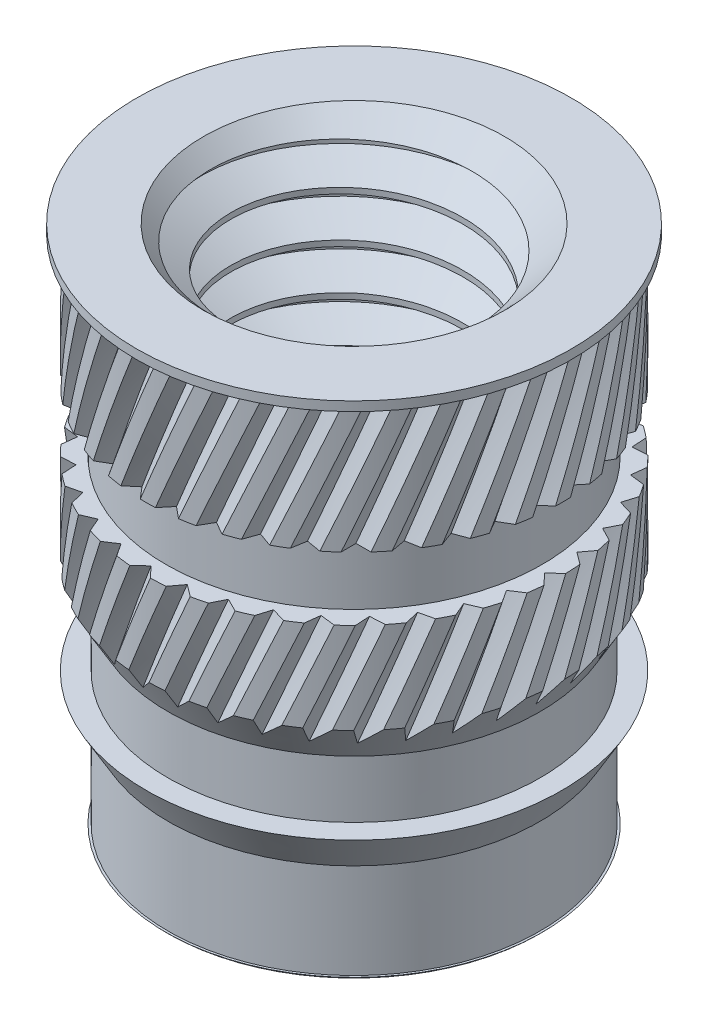
from build123d import *

# Parameters (mm, degrees)
SKETCH1_R              = 5.095
EXTRUDE1_DEPTH         = 14.3
SKETCH1_4_R            = 5.69
EXTRUDE2_DEPTH         = 8.005853
SKETCH1_3_R            = 5.955
EXTRUDE3_DEPTH         = 0.254
SKETCH2_R              = 5.69
EXTRUDE4_DEPTH         = 1.03057
EXTRUDE4_TAPER         = 30
SKETCH8_R              = 3.188101184
EXTRUDE6_DEPTH         = 14.3
CHAMFER1_SIZE          = 0.9375
CUT_SWEEP1_PITCH       = 1.25
CUT_SWEEP1_HEIGHT      = 15.864159265
CUT_SWEEP1_RADIUS      = 4
CUT_SWEEP1_START_ANGLE = -90
CUT_SWEEP2_PITCH       = 86.785
CUT_SWEEP2_HEIGHT      = 8.6785
CUT_SWEEP2_RADIUS      = 5.69
CUT_SWEEP2_START_ANGLE = -180
CIRPATTERN1_COUNT      = 36
SKETCH11_W             = 0.8
SKETCH11_H             = 1.7357


# Read off the part's stored shape, not the designer's step: Extrude5
with BuildPart() as part:
    # Sketch1 → Extrude1 (new body)
    with BuildSketch(Plane(origin=(0, 0, 0), x_dir=(1, 0, 0), z_dir=(0, 1, 0))):
        with Locations(Location((0, 0, 0), (0, 0, 270))):
            Circle(SKETCH1_R)
    extrude(amount=-EXTRUDE1_DEPTH)

    # Sketch1<4> → Extrude2 (add)
    with BuildSketch(Plane(origin=(0, 0, 0), x_dir=(1, 0, 0), z_dir=(0, 1, 0))):
        with Locations(Location((0, 0, 0), (0, 0, 270))):
            Circle(SKETCH1_4_R)
    extrude(amount=-EXTRUDE2_DEPTH)

    # Sketch1<3> → Extrude3 (add)
    with BuildSketch(Plane(origin=(0, 0, 0), x_dir=(1, 0, 0), z_dir=(0, 1, 0))):
        with Locations(Location((0, 0, 0), (0, 0, 270))):
            Circle(SKETCH1_3_R)
    extrude(amount=-EXTRUDE3_DEPTH)

    # Sketch2 → Extrude4 (add)
    with BuildSketch(Plane.XZ.offset(8.005852818)):
        with Locations(Location((0, 0, 0), (0, 0, 90))):
            Circle(SKETCH2_R)
    extrude(amount=EXTRUDE4_DEPTH, taper=EXTRUDE4_TAPER)

    # Extrude5 outline → Extrude5 (revolve)
    with BuildSketch(Plane.XY):
        Polygon((5.095, -14.24), (5.095, -14.3), (5.155, -14.24), align=None)
    revolve(axis=Axis((0, 0, 0), (0, 1, 0)))

    # Sketch5 → Revolve1 (revolve)
    with BuildSketch(Plane.XY):
        Polygon((-5.095, -11.638211524), (-5.69, -10.607641294), (-5.095, -10.607641294), align=None)
    revolve(axis=Axis((0, 0, 0), (0, -1, 0)))

    # Sketch8 → Extrude6 (cut)
    with BuildSketch(Plane(origin=(0, 0, 0), x_dir=(1, 0, 0), z_dir=(0, 1, 0))):
        with Locations(Location((0, 0, 0), (0, 0, 270))):
            Circle(SKETCH8_R)
    extrude(amount=-EXTRUDE6_DEPTH, mode=Mode.SUBTRACT)

    # Chamfer1
    chamfer1_edges = [part.edges().sort_by_distance(p)[0] for p in [
        (0, -14.3, -3.188101184),
        (0, 0, -3.188101184),
    ]]
    chamfer(chamfer1_edges, length=CHAMFER1_SIZE)

    # Cut-Sweep1: sweep along a helix
    with BuildLine() as cut_sweep1_path:
        add(Helix(CUT_SWEEP1_PITCH, CUT_SWEEP1_HEIGHT, CUT_SWEEP1_RADIUS, center=(0, 0, 0), direction=(0, -1, 0), mode=Mode.PRIVATE).rotate(Axis((0, 0, 0), (0, -1, 0)), CUT_SWEEP1_START_ANGLE))
    # Sketch7 → Cut-Sweep1 (sweep, cut)
    with BuildSketch(Plane.XY):
        Polygon((-4, 0.625), (-4, 0.46875), (-3.120442949, -0.0390625), (-3.120442949, 1.1328125), align=None)
    sweep(path=cut_sweep1_path.line, is_frenet=True, mode=Mode.SUBTRACT)

    # Cut-Sweep2: sweep along a helix
    with BuildLine() as cut_sweep2_path:
        add(Helix(CUT_SWEEP2_PITCH, CUT_SWEEP2_HEIGHT, CUT_SWEEP2_RADIUS, center=(0, -0.254, 0), direction=(0, -1, 0), mode=Mode.PRIVATE).rotate(Axis((0, -0.254, 0), (0, -1, 0)), CUT_SWEEP2_START_ANGLE))
    # Sketch10 → Cut-Sweep2 (sweep, cut)
    with BuildSketch(Plane.XZ.offset(0.254)):
        Polygon((0, 5.3925), (-0.2975, 5.69), (0.2975, 5.69), align=None)
    cut_sweep2 = sweep(path=cut_sweep2_path.line, is_frenet=True, mode=Mode.SUBTRACT)

    # CirPattern1: Cut-Sweep2 ×36 about axis
    cirpattern1_axis = Axis((0, -8.005852818, 0), (0, 1, 0))
    for i in range(1, CIRPATTERN1_COUNT):
        add(cut_sweep2.rotate(cirpattern1_axis, i * 360 / CIRPATTERN1_COUNT), mode=Mode.SUBTRACT)

    # Sketch11 → Cut-Revolve1 (revolve, cut)
    with BuildSketch(Plane.XY):
        with Locations((-5.555, -4.645211524)):
            Rectangle(SKETCH11_W, SKETCH11_H)
    revolve(axis=Axis((0, 0, 0), (0, -1, 0)), mode=Mode.SUBTRACT)


solid = part.part
